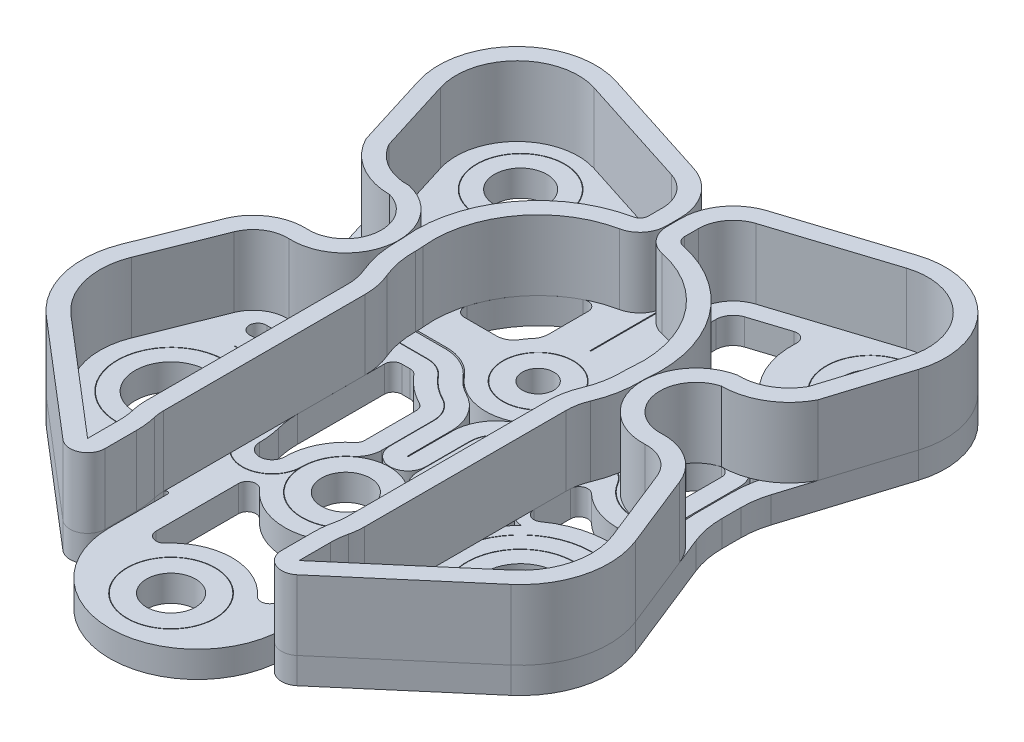
from build123d import *

# Parameters (mm, degrees)
BOSS_EXTRUDE1_START       = -3
BOSS_EXTRUDE1_OUTLINE_R   = 4.125000006
BOSS_EXTRUDE1_OUTLINE_R_2 = 2.8
BOSS_EXTRUDE1_OUTLINE_R_3 = 4.124999988
BOSS_EXTRUDE1_OUTLINE_R_4 = 1.800000002
BOSS_EXTRUDE1_OUTLINE_R_5 = 2.999999989
BOSS_EXTRUDE1_OUTLINE_R_6 = 3
BOSS_EXTRUDE1_DEPTH       = 3
EXTRUDE_THIN1_DEPTH       = 8
CUT_EXTRUDE_THIN1_START   = -3
SKETCH5_R                 = 5.049999989
SKETCH5_R_2               = 4.999999989
SKETCH5_R_3               = 5.05
SKETCH5_R_4               = 5
SKETCH5_R_5               = 4.05
SKETCH5_R_6               = 4
SKETCH5_R_7               = 5.050000041
SKETCH5_R_8               = 5.000000041
SKETCH5_R_9               = 6.175000006
SKETCH5_R_10              = 6.125000006
SKETCH5_R_11              = 6.174999988
SKETCH5_R_12              = 6.124999988
SKETCH5_R_13              = 5.049999983
SKETCH5_R_14              = 4.999999983
CUT_EXTRUDE_THIN1_DEPTH   = 3


# Read off the part's stored shape, not the designer's step: Boss-Extrude1
with BuildPart() as part:
    # Boss-Extrude1 outline → Boss-Extrude1 (new body)
    with BuildSketch(Plane(origin=(0, 0, 0), x_dir=(1, 0, 0), z_dir=(0, 1, 0)).offset(BOSS_EXTRUDE1_START)):
        with BuildLine():
            ThreePointArc((10.366684446, -31.537922044), (10.166894874, -32.677211811), (10.100000021, -33.831950797))
            Line((10.100000021, -33.831950797), (10.100000021, -37.450766032))
            ThreePointArc((10.100000021, -37.450766032), (11.263415083, -39.267390826), (13.400125663, -38.970526973))
            Line((13.400125663, -38.970526973), (26.581886082, -27.693789751))
            ThreePointArc((26.581886082, -27.693789751), (29.830051388, -22.426049301), (29.405725801, -16.251940856))
            Line((29.405725801, -16.251940856), (24.835394483, -4.782729235))
            ThreePointArc((24.835394483, -4.782729235), (24.304204469, -2.965609858), (24.125000186, -1.080942384))
            Line((24.125000186, -1.080942384), (24.125000186, 1.080942114))
            ThreePointArc((24.125000186, 1.080942114), (24.239058088, 2.586979102), (24.578629813, 4.058661017))
            Line((24.578629813, 4.058661017), (28.591733604, 16.924407756))
            ThreePointArc((28.591733604, 16.924407756), (26.338601086, 25.993575357), (17.251798885, 28.174500129))
            Line((17.251798885, 28.174500129), (4.217865917, 23.994889669))
            ThreePointArc((4.217865917, 23.994889669), (1.202691228, 21.817502134), (0.049999988, 18.281459461))
            Line((0.049999988, 18.281459461), (0.049999988, 7.999791662))
            ThreePointArc((0.049999988, 7.999791662), (-4.5e-08, 7.94979163), (-0.050000077, 7.999791662))
            Line((-0.050000077, 7.999791662), (-0.050000077, 18.28145946))
            ThreePointArc((-0.050000077, 18.28145946), (-1.202691317, 21.817502134), (-4.217866006, 23.994889669))
            Line((-4.217866006, 23.994889669), (-17.251798974, 28.174500129))
            ThreePointArc((-17.251798974, 28.174500129), (-26.33860103, 25.993575269), (-28.591733546, 16.924407792))
            Line((-28.591733546, 16.924407792), (-24.578629771, 4.058661048))
            ThreePointArc((-24.578629771, 4.058661048), (-24.239058048, 2.586979133), (-24.125000147, 1.080942144))
            Line((-24.125000147, 1.080942144), (-24.12500015, -1.080942354))
            ThreePointArc((-24.12500015, -1.080942354), (-24.304204435, -2.965609828), (-24.835394452, -4.782729204))
            Line((-24.835394452, -4.782729204), (-29.405725784, -16.251940819))
            ThreePointArc((-29.405725784, -16.251940819), (-29.830051377, -22.42604928), (-26.581886075, -27.693789751))
            Line((-26.581886075, -27.693789751), (-13.400125624, -38.970526972))
            ThreePointArc((-13.400125624, -38.970526972), (-11.263415045, -39.267390826), (-10.099999983, -37.450766032))
            Line((-10.099999983, -37.450766032), (-10.099999983, -33.831950797))
            ThreePointArc((-10.099999983, -33.831950797), (-10.166894835, -32.677211811), (-10.366684408, -31.537922044))
            ThreePointArc((-10.366684408, -31.537922044), (-10.467591951, -30.959497747), (-10.499995379, -30.373232433))
            ThreePointArc((-10.499995379, -30.373232433), (-10.24955658, -30.124118101), (-9.999999983, -30.374116195))
            Line((-9.999999983, -30.374116195), (-9.999999983, -36.999999952))
            ThreePointArc((-9.999999983, -36.999999952), (3e-09, -46.999999937), (9.999999989, -36.999999952))
            Line((9.999999989, -36.999999952), (9.999999989, -30.374999952))
            ThreePointArc((9.999999989, -30.374999952), (10.24911623, -30.125001514), (10.499993741, -30.373232445))
            ThreePointArc((10.499993741, -30.373232445), (10.46759199, -30.959497747), (10.366684446, -31.537922044))
        make_face()
        with BuildLine():
            Line((-12.499999988, -29.028600358), (-12.499982882, -30.36616234))
            ThreePointArc((-12.499982882, -30.36616234), (-12.454618084, -31.186933779), (-12.313347523, -31.996727795))
            ThreePointArc((-12.313347523, -31.996727795), (-12.153515864, -32.908159608), (-12.099999983, -33.831950797))
            Line((-12.099999983, -33.831950797), (-12.099999983, -37.450766032))
            Line((-12.099999983, -37.450766032), (-18.789338773, -31.728167961))
            ThreePointArc((-18.789338773, -31.728167961), (-19.103097329, -30.701738639), (-18.306532101, -29.982374043))
            ThreePointArc((-18.306532101, -29.982374043), (-16.094353466, -29.341389081), (-14.084269657, -28.217040775))
            ThreePointArc((-14.084269657, -28.217040775), (-13.044077663, -28.138580786), (-12.499999988, -29.028600358))
        make_face(mode=Mode.SUBTRACT)
        with Locations((-19.999999908, -20.000000019)):
            Circle(BOSS_EXTRUDE1_OUTLINE_R, mode=Mode.SUBTRACT)
        with BuildLine():
            Line((-11.800000029, -12.520592954), (-11.800000029, -15.023492615))
            ThreePointArc((-11.800000029, -15.023492615), (-11.799396788, -15.140252604), (-11.797587127, -15.257000126))
            ThreePointArc((-11.797587127, -15.257000126), (-12.499913264, -14.209980688), (-13.3350313, -13.265475752))
            ThreePointArc((-13.3350313, -13.265475752), (-12.495888638, -13.040641099), (-11.800000029, -12.520592954))
        make_face(mode=Mode.SUBTRACT)
        with BuildLine():
            ThreePointArc((-7.000000022, -20.000000001), (-8.437500022, -21.437500001), (-9.875000022, -20.000000001))
            ThreePointArc((-9.875000022, -20.000000001), (-9.953917828, -18.738311629), (-10.189441019, -17.496291342))
            ThreePointArc((-10.189441019, -17.496291342), (-10.422056523, -16.269604636), (-10.500000041, -15.023492661))
            Line((-10.500000041, -15.023492661), (-10.500000041, -5.1))
            ThreePointArc((-10.500000041, -5.1), (-10.207106823, -4.392893218), (-9.500000041, -4.1))
            Line((-9.500000041, -4.1), (-8.532291636, -4.1))
            ThreePointArc((-8.532291636, -4.1), (-8.107815272, -4.194560982), (-7.763616711, -4.460360368))
            ThreePointArc((-7.763616711, -4.460360368), (-6.307868974, -5.88801555), (-4.595045074, -6.994195953))
            ThreePointArc((-4.595045074, -6.994195953), (-4.197077126, -7.362673507), (-4.050000029, -7.884710405))
            Line((-4.050000029, -7.884710405), (-4.050000029, -13.795364617))
            ThreePointArc((-4.050000029, -13.795364617), (-4.146880436, -14.224753722), (-4.418750031, -14.570944045))
            ThreePointArc((-4.418750031, -14.570944045), (-6.321837178, -16.994276291), (-7.000000022, -20.000000001))
        make_face(mode=Mode.SUBTRACT)
        with Locations((1.9e-08, -40.000000001)):
            Circle(BOSS_EXTRUDE1_OUTLINE_R_2, mode=Mode.SUBTRACT)
        with BuildLine():
            ThreePointArc((-5.249999973, -35.369935327), (-6.353553365, -35.643911857), (-6.999999981, -34.708497509))
            Line((-6.999999981, -34.708497509), (-6.999999981, -25.291502623))
            ThreePointArc((-6.999999981, -25.291502623), (-6.353553371, -24.356088277), (-5.249999981, -24.630064796))
            ThreePointArc((-5.249999981, -24.630064796), (1.9e-08, -27.000000001), (5.250000019, -24.630064796))
            ThreePointArc((5.250000019, -24.630064796), (6.353553409, -24.356088277), (7.000000019, -25.291502623))
            Line((7.000000019, -25.291502623), (7.000000019, -34.708497509))
            ThreePointArc((7.000000019, -34.708497509), (6.353553404, -35.643911857), (5.250000011, -35.369935327))
            ThreePointArc((5.250000011, -35.369935327), (1.9e-08, -33.000000087), (-5.249999973, -35.369935327))
        make_face(mode=Mode.SUBTRACT)
        with BuildLine():
            ThreePointArc((12.100000021, -33.831950797), (12.153515903, -32.908159608), (12.313347561, -31.996727795))
            ThreePointArc((12.313347561, -31.996727795), (12.454618123, -31.186933779), (12.499982921, -30.36616234))
            Line((12.499982921, -30.36616234), (12.500000027, -29.028600358))
            ThreePointArc((12.500000027, -29.028600358), (13.044077702, -28.138580786), (14.084269696, -28.217040774))
            ThreePointArc((14.084269696, -28.217040774), (16.09435347, -29.341389067), (18.306532066, -29.982374031))
            ThreePointArc((18.306532066, -29.982374031), (19.103097358, -30.701738603), (18.789338812, -31.728167961))
            Line((18.789338812, -31.728167961), (12.100000021, -37.450766032))
            Line((12.100000021, -37.450766032), (12.100000021, -33.831950797))
        make_face(mode=Mode.SUBTRACT)
        with Locations((5e-08, -20.000000023)):
            Circle(BOSS_EXTRUDE1_OUTLINE_R_2, mode=Mode.SUBTRACT)
        with BuildLine():
            ThreePointArc((9.499999996, -4.100000011), (10.207106869, -4.392893148), (10.500000169, -5.099999954))
            Line((10.500000169, -5.099999954), (10.500000169, -15.023492615))
            ThreePointArc((10.500000169, -15.023492615), (10.422056655, -16.269604611), (10.189441149, -17.496291337))
            ThreePointArc((10.189441149, -17.496291337), (9.953917952, -18.738311635), (9.875000145, -20.000000019))
            ThreePointArc((9.875000145, -20.000000019), (8.437500094, -21.437500052), (7.000000061, -20.000000001))
            ThreePointArc((7.000000061, -20.000000001), (6.32183723, -16.994276317), (4.418750115, -14.570944082))
            ThreePointArc((4.418750115, -14.570944082), (4.146880525, -14.22475376), (4.05000012, -13.795364659))
            Line((4.05000012, -13.795364659), (4.05000012, -7.884710518))
            ThreePointArc((4.05000012, -7.884710518), (4.197077165, -7.362673618), (4.595045084, -6.99419605))
            ThreePointArc((4.595045084, -6.99419605), (6.307868993, -5.888015628), (7.763616737, -4.460360426))
            ThreePointArc((7.763616737, -4.460360426), (8.107815259, -4.194561029), (8.532291591, -4.100000011))
            Line((8.532291591, -4.100000011), (9.499999996, -4.100000011))
        make_face(mode=Mode.SUBTRACT)
        with BuildLine():
            Line((11.800000129, -15.023492614), (11.800000129, -12.520592954))
            ThreePointArc((11.800000129, -12.520592954), (12.495888738, -13.040641098), (13.3350314, -13.265475751))
            ThreePointArc((13.3350314, -13.265475751), (12.499913364, -14.209980687), (11.797587227, -15.257000125))
            ThreePointArc((11.797587227, -15.257000125), (11.799396888, -15.140252603), (11.800000129, -15.023492614))
        make_face(mode=Mode.SUBTRACT)
        with Locations((20.000000088, -20.000000019)):
            Circle(BOSS_EXTRUDE1_OUTLINE_R_3, mode=Mode.SUBTRACT)
        with BuildLine():
            ThreePointArc((-12.500000041, -10.971399616), (-13.044077714, -11.861419184), (-14.084269704, -11.782959203))
            ThreePointArc((-14.084269704, -11.782959203), (-17.375409345, -10.22108654), (-21.006312458, -9.92513226))
            ThreePointArc((-21.006312458, -9.92513226), (-22.069812691, -8.962566143), (-21.006312458, -8.000000025))
            Line((-21.006312458, -8.000000025), (-19.000000038, -8.000000025))
            ThreePointArc((-19.000000038, -8.000000025), (-16.40992615, -7.503192876), (-14.187500041, -6.08329067))
            ThreePointArc((-14.187500041, -6.08329067), (-13.104715334, -5.890916394), (-12.500000041, -6.809475047))
            Line((-12.500000041, -6.809475047), (-12.500000041, -10.971399616))
        make_face(mode=Mode.SUBTRACT)
        with BuildLine():
            ThreePointArc((-19, 4), (-17.025158234, 3.478505426), (-15.565251101, 2.05))
            ThreePointArc((-15.565251101, 2.05), (-14.105343968, 0.621494574), (-12.130502202, 0.1))
            Line((-12.130502202, 0.1), (-8.566796367, 0.1))
            ThreePointArc((-8.566796367, 0.1), (-6.408303627, -0.389910301), (-4.672798019, -1.763636364))
            ThreePointArc((-4.672798019, -1.763636364), (0, -4), (4.672798019, -1.763636364))
            ThreePointArc((4.672798019, -1.763636364), (6.408303627, -0.389910301), (8.566796367, 0.1))
            Line((8.566796367, 0.1), (12.130502313, 0.1))
            ThreePointArc((12.130502313, 0.1), (14.599054505, 0.751868209), (16.423938419, 2.53749997))
            ThreePointArc((16.423938419, 2.53749997), (17.518868733, 3.608878994), (19.000000003, 3.999999907))
            ThreePointArc((19.000000003, 3.999999907), (19.707106773, 3.70710674), (19.999999982, 2.999999987))
            Line((19.999999982, 2.999999987), (19.999999982, -3.000000013))
            ThreePointArc((19.999999982, -3.000000013), (19.707106794, -3.707106719), (19.000000088, -3.999999907))
            ThreePointArc((19.000000088, -3.999999907), (17.518868765, -3.608879012), (16.423938412, -2.537499959))
            ThreePointArc((16.423938412, -2.537499959), (14.599054496, -0.751868185), (12.130502295, -0.099999971))
            Line((12.130502295, -0.099999971), (8.532291702, -0.099999971))
            ThreePointArc((8.532291702, -0.099999971), (6.409909857, -0.572804886), (4.688917035, -1.901801836))
            ThreePointArc((4.688917035, -1.901801836), (3.809703055, -2.764049031), (2.775225253, -3.43213819))
            ThreePointArc((2.775225253, -3.43213819), (0.785385542, -5.274525951), (0.050000069, -7.884710416))
            Line((0.050000069, -7.884710416), (0.050000069, -12.89999996))
            ThreePointArc((0.050000069, -12.89999996), (1.5e-08, -12.950000013), (-0.050000038, -12.89999996))
            Line((-0.050000038, -12.89999996), (-0.050000038, -7.884710416))
            ThreePointArc((-0.050000038, -7.884710416), (-0.785385526, -5.274525927), (-2.775225263, -3.432138156))
            ThreePointArc((-2.775225263, -3.432138156), (-3.809703045, -2.764048994), (-4.688917007, -1.901801802))
            ThreePointArc((-4.688917007, -1.901801802), (-6.409909803, -0.572804898), (-8.532291603, -0.1))
            Line((-8.532291603, -0.1), (-12.130502202, -0.1))
            ThreePointArc((-12.130502202, -0.1), (-14.105343968, -0.621494574), (-15.565251101, -2.05))
            ThreePointArc((-15.565251101, -2.05), (-17.025158234, -3.478505426), (-19, -4))
            ThreePointArc((-19, -4), (-19.70710676, -3.707106785), (-19.999999975, -3.000000013))
            Line((-19.999999975, -3.000000013), (-19.999999975, 3))
            ThreePointArc((-19.999999975, 3), (-19.707106765, 3.707106772), (-19, 4))
        make_face(mode=Mode.SUBTRACT)
        with BuildLine():
            ThreePointArc((-5.508883445, 12.666376335), (-4.529847832, 12.631953466), (-4.05, 11.777879861))
            Line((-4.05, 11.777879861), (-4.05, 7.234262126))
            ThreePointArc((-4.05, 7.234262126), (-4.175833519, 6.536050124), (-4.5375, 5.925696594))
            ThreePointArc((-4.5375, 5.925696594), (-4.863447474, 5.513812554), (-5.152123349, 5.075))
            ThreePointArc((-5.152123349, 5.075), (-5.882076915, 4.360747287), (-6.869497798, 4.1))
            Line((-6.869497798, 4.1), (-10.559329267, 4.1))
            ThreePointArc((-10.559329267, 4.1), (-11.359857476, 4.500704926), (-11.518834493, 5.381690827))
            ThreePointArc((-11.518834493, 5.381690827), (-9.26026216, 9.639824975), (-5.508883445, 12.666376335))
        make_face(mode=Mode.SUBTRACT)
        with Locations((-8e-09, 2.000000028)):
            Circle(BOSS_EXTRUDE1_OUTLINE_R_4, mode=Mode.SUBTRACT)
        with Locations((-19.999999908, 20.000000019)):
            Circle(BOSS_EXTRUDE1_OUTLINE_R_5, mode=Mode.SUBTRACT)
        with BuildLine():
            ThreePointArc((-4.050000077, 16.129639772), (-4.232517636, 15.553686251), (-4.713444993, 15.187975991))
            ThreePointArc((-4.713444993, 15.187975991), (-9.755393979, 12.04846071), (-13.042728056, 7.101619249))
            ThreePointArc((-13.042728056, 7.101619249), (-13.675903647, 6.511361893), (-14.532462816, 6.636347754))
            ThreePointArc((-14.532462816, 6.636347754), (-16.664489566, 7.651495999), (-19, 8))
            Line((-19, 8), (-20.570425549, 8))
            ThreePointArc((-20.570425549, 8), (-21.162974326, 8.194465428), (-21.5250626, 8.702228106))
            Line((-21.5250626, 8.702228106), (-21.953069074, 10.074388629))
            ThreePointArc((-21.953069074, 10.074388629), (-21.789238639, 10.799431359), (-21.095724924, 11.066949767))
            ThreePointArc((-21.095724924, 11.066949767), (-13.835038202, 13.443076459), (-11.016438541, 20.543713451))
            ThreePointArc((-11.016438541, 20.543713451), (-10.631750688, 21.393831932), (-9.712909372, 21.556364423))
            Line((-9.712909372, 21.556364423), (-5.43928872, 20.185936201))
            ThreePointArc((-5.43928872, 20.185936201), (-4.43423049, 19.460140356), (-4.050000077, 18.281459465))
            Line((-4.050000077, 18.281459465), (-4.050000077, 16.129639772))
        make_face(mode=Mode.SUBTRACT)
        with BuildLine():
            ThreePointArc((2.050000134, -7.884710456), (2.49123142, -6.318599774), (3.685135246, -5.213167112))
            ThreePointArc((3.685135246, -5.213167112), (5.058786093, -4.326032313), (6.226266944, -3.181081107))
            ThreePointArc((6.226266944, -3.181081107), (7.258862613, -2.383682894), (8.532291719, -2.099999905))
            Line((8.532291719, -2.099999905), (12.130502296, -2.099999905))
            ThreePointArc((12.130502296, -2.099999905), (13.611633621, -2.491120835), (14.706563971, -3.562499905))
            ThreePointArc((14.706563971, -3.562499905), (16.53144789, -5.348131689), (19.0000001, -5.999999907))
            ThreePointArc((19.0000001, -5.999999907), (21.121320357, -5.121320282), (21.999999982, -3.000000013))
            Line((21.999999982, -3.000000013), (21.999999982, 3.000000013))
            ThreePointArc((21.999999982, 3.000000013), (21.121320327, 5.121320312), (19.000000003, 5.999999907))
            Line((19.000000003, 5.999999907), (20.570425648, 5.999999907))
            ThreePointArc((20.570425648, 5.999999907), (22.348071979, 6.58339619), (23.434336801, 8.106684225))
            Line((23.434336801, 8.106684225), (22.669355526, 5.654204715))
            ThreePointArc((22.669355526, 5.654204715), (22.261869626, 3.888186581), (22.125000258, 2.080942384))
            Line((22.125000258, 2.080942384), (22.125000258, -2.080942384))
            ThreePointArc((22.125000258, -2.080942384), (22.261869656, -3.888186776), (22.669355643, -5.654205092))
            Line((22.669355643, -5.654205092), (23.434336829, -8.106684315))
            ThreePointArc((23.434336829, -8.106684315), (22.561254366, -6.755762693), (21.115861254, -6.050000006))
            Line((21.115861254, -6.050000006), (19.0000001, -6.050000006))
            ThreePointArc((19.0000001, -6.050000006), (16.514517402, -5.396006805), (14.67279264, -3.603416153))
            ThreePointArc((14.67279264, -3.603416153), (13.578698723, -2.538510816), (12.10217435, -2.150000004))
            Line((12.10217435, -2.150000004), (8.532291719, -2.150000004))
            ThreePointArc((8.532291719, -2.150000004), (7.280086445, -2.428954899), (6.26470069, -3.213063088))
            ThreePointArc((6.26470069, -3.213063088), (5.090013168, -4.365081895), (3.707882994, -5.257692835))
            ThreePointArc((3.707882994, -5.257692835), (2.533877565, -6.344701619), (2.100000134, -7.884710456))
            Line((2.100000134, -7.884710456), (2.100000134, -13.795364632))
            ThreePointArc((2.100000134, -13.795364632), (2.385797318, -15.062062475), (3.1878126, -16.083323923))
            ThreePointArc((3.1878126, -16.083323923), (4.560754048, -17.831585049), (5.050000103, -20.000000019))
            ThreePointArc((5.050000103, -20.000000019), (8.437500108, -23.38750001), (11.825000103, -20.00000001))
            ThreePointArc((11.825000103, -20.00000001), (14.514181846, -13.93894211), (20.812504202, -11.865477179))
            ThreePointArc((20.812504202, -11.865477179), (20.834895697, -11.892838118), (20.807534758, -11.915229612))
            ThreePointArc((20.807534758, -11.915229612), (14.547734251, -13.9760128), (11.875000103, -20.00000001))
            ThreePointArc((11.875000103, -20.00000001), (8.437500108, -23.43750001), (5.000000103, -20.000000021))
            ThreePointArc((5.000000103, -20.000000021), (5.1e-08, -14.99999997), (-5.000000003, -20.000000019))
            ThreePointArc((-5.000000003, -20.000000019), (-8.437500003, -23.437500019), (-11.875000003, -20.000000019))
            ThreePointArc((-11.875000003, -20.000000019), (-14.547734148, -13.976012803), (-20.807534658, -11.915229612))
            ThreePointArc((-20.807534658, -11.915229612), (-20.834895597, -11.892838118), (-20.812504102, -11.865477179))
            ThreePointArc((-20.812504102, -11.865477179), (-14.514181743, -13.938942113), (-11.825000003, -20.000000019))
            ThreePointArc((-11.825000003, -20.000000019), (-8.437500003, -23.387500019), (-5.050000003, -20.000000019))
            ThreePointArc((-5.050000003, -20.000000019), (-4.560753949, -17.831585049), (-3.187812501, -16.083323923))
            ThreePointArc((-3.187812501, -16.083323923), (-2.385797219, -15.062062475), (-2.100000034, -13.795364632))
            Line((-2.100000034, -13.795364632), (-2.100000034, -7.884710456))
            ThreePointArc((-2.100000034, -7.884710456), (-2.533877466, -6.344701619), (-3.707882895, -5.257692835))
            ThreePointArc((-3.707882895, -5.257692835), (-5.090013068, -4.365081895), (-6.26470059, -3.213063088))
            ThreePointArc((-6.26470059, -3.213063088), (-7.280086345, -2.428954899), (-8.532291619, -2.150000004))
            Line((-8.532291619, -2.150000004), (-12.102174251, -2.150000004))
            ThreePointArc((-12.102174251, -2.150000004), (-13.578698624, -2.538510816), (-14.67279254, -3.603416153))
            ThreePointArc((-14.67279254, -3.603416153), (-16.514517303, -5.396006805), (-19, -6.050000006))
            Line((-19, -6.050000006), (-21.670047442, -6.050000006))
            ThreePointArc((-21.670047442, -6.050000006), (-22.413378339, -6.300483225), (-23.065105729, -6.736985315))
            ThreePointArc((-23.065105729, -6.736985315), (-22.362374299, -4.45594419), (-22.125000129, -2.080942384))
            Line((-22.125000129, -2.080942384), (-22.125000129, 2.080942377))
            ThreePointArc((-22.125000129, 2.080942377), (-22.261869527, 3.888186774), (-22.669355515, 5.654205095))
            Line((-22.669355515, 5.654205095), (-23.434336702, 8.106684317))
            ThreePointArc((-23.434336702, 8.106684317), (-22.348071879, 6.583396283), (-20.570425549, 6))
            Line((-20.570425549, 6), (-18.999999988, 6))
            ThreePointArc((-18.999999988, 6), (-21.121320327, 5.121320345), (-21.999999982, 3.000000006))
            Line((-21.999999982, 3.000000006), (-21.999999982, -3.000000013))
            ThreePointArc((-21.999999982, -3.000000013), (-21.121320327, -5.121320352), (-18.999999988, -6.000000006))
            ThreePointArc((-18.999999988, -6.000000006), (-16.53144779, -5.348131788), (-14.706563871, -3.562500004))
            ThreePointArc((-14.706563871, -3.562500004), (-13.611633521, -2.491120934), (-12.130502197, -2.100000004))
            Line((-12.130502197, -2.100000004), (-8.532291619, -2.100000004))
            ThreePointArc((-8.532291619, -2.100000004), (-7.258862527, -2.383682949), (-6.226266844, -3.181081107))
            ThreePointArc((-6.226266844, -3.181081107), (-5.058785993, -4.326032313), (-3.685135147, -5.213167112))
            ThreePointArc((-3.685135147, -5.213167112), (-2.49123132, -6.318599774), (-2.050000034, -7.884710456))
            Line((-2.050000034, -7.884710456), (-2.050000034, -12.899999964))
            ThreePointArc((-2.050000034, -12.899999964), (5e-08, -14.950000048), (2.050000134, -12.899999964))
            Line((2.050000134, -12.899999964), (2.050000134, -7.884710456))
        make_face(mode=Mode.SUBTRACT)
        with BuildLine():
            ThreePointArc((11.518834493, 5.381690827), (11.359857476, 4.500704926), (10.559329267, 4.1))
            Line((10.559329267, 4.1), (6.869497798, 4.1))
            ThreePointArc((6.869497798, 4.1), (5.882076915, 4.360747287), (5.152123349, 5.075))
            ThreePointArc((5.152123349, 5.075), (4.863447474, 5.513812554), (4.5375, 5.925696594))
            ThreePointArc((4.5375, 5.925696594), (4.175833519, 6.536050124), (4.05, 7.234262126))
            Line((4.05, 7.234262126), (4.05, 11.777879861))
            ThreePointArc((4.05, 11.777879861), (4.529847832, 12.631953466), (5.508883445, 12.666376335))
            ThreePointArc((5.508883445, 12.666376335), (9.26026216, 9.639824975), (11.518834493, 5.381690827))
        make_face(mode=Mode.SUBTRACT)
        with BuildLine():
            ThreePointArc((14.084269789, -11.782959204), (13.0440778, -11.861419183), (12.500000129, -10.971399616))
            Line((12.500000129, -10.971399616), (12.500000129, -6.809475023))
            ThreePointArc((12.500000129, -6.809475023), (13.104715416, -5.890916372), (14.18750012, -6.083290638))
            ThreePointArc((14.18750012, -6.083290638), (16.409926182, -7.503192788), (19.000000003, -7.999999916))
            Line((19.000000003, -7.999999916), (20.735075088, -7.999999916))
            ThreePointArc((20.735075088, -7.999999916), (21.757665243, -8.950859212), (20.735075088, -9.901718508))
            ThreePointArc((20.735075088, -9.901718508), (17.244176441, -10.257256013), (14.084269789, -11.782959204))
        make_face(mode=Mode.SUBTRACT)
        with BuildLine():
            ThreePointArc((9.712909332, 21.556364462), (10.63175065, 21.393831969), (11.016438501, 20.543713485))
            ThreePointArc((11.016438501, 20.543713485), (13.729487537, 13.543942809), (20.805375194, 11.0361074))
            ThreePointArc((20.805375194, 11.0361074), (21.673048481, 10.668151791), (21.849498388, 9.742347442))
            Line((21.849498388, 9.742347442), (21.525062699, 8.702228013))
            ThreePointArc((21.525062699, 8.702228013), (21.162974425, 8.194465335), (20.570425648, 7.999999907))
            Line((20.570425648, 7.999999907), (19.000000003, 7.999999907))
            ThreePointArc((19.000000003, 7.999999907), (16.705415945, 7.613235419), (14.664392927, 6.49568103))
            ThreePointArc((14.664392927, 6.49568103), (13.776739918, 6.317437508), (13.108996115, 6.928843126))
            ThreePointArc((13.108996115, 6.928843126), (9.821566576, 11.983792066), (4.713444909, 15.187976016))
            ThreePointArc((4.713444909, 15.187976016), (4.232517551, 15.553686275), (4.049999992, 16.129639796))
            Line((4.049999992, 16.129639796), (4.049999992, 18.28145949))
            ThreePointArc((4.049999992, 18.28145949), (4.434230406, 19.460140381), (5.439288635, 20.185936226))
            Line((5.439288635, 20.185936226), (9.712909332, 21.556364462))
        make_face(mode=Mode.SUBTRACT)
        with Locations((19.999999943, 20)):
            Circle(BOSS_EXTRUDE1_OUTLINE_R_6, mode=Mode.SUBTRACT)
    extrude(amount=BOSS_EXTRUDE1_DEPTH)

    # Sketch5 → Cut-Extrude-Thin1 (cut)
    # profile 1 of 7: a face of its own
    with BuildSketch(Plane(origin=(0, 0, 0), x_dir=(1, 0, 0), z_dir=(0, 1, 0)).offset(CUT_EXTRUDE_THIN1_START)):
        with Locations((-19.999999908, 20.000000019)):
            Circle(SKETCH5_R)
        with Locations((-19.999999908, 20.000000019)):
            Circle(SKETCH5_R_2, mode=Mode.SUBTRACT)
    # profile 2 of 7: a face of its own
    with BuildSketch(Plane(origin=(0, 0, 0), x_dir=(1, 0, 0), z_dir=(0, 1, 0)).offset(CUT_EXTRUDE_THIN1_START)):
        with Locations((19.999999943, 20)):
            Circle(SKETCH5_R_3)
        with Locations((19.999999943, 20)):
            Circle(SKETCH5_R_4, mode=Mode.SUBTRACT)
    # profile 3 of 7: a face of its own
    with BuildSketch(Plane(origin=(0, 0, 0), x_dir=(1, 0, 0), z_dir=(0, 1, 0)).offset(CUT_EXTRUDE_THIN1_START)):
        with Locations((0, 2)):
            Circle(SKETCH5_R_5)
        with Locations((0, 2)):
            Circle(SKETCH5_R_6, mode=Mode.SUBTRACT)
    # profile 4 of 7: a face of its own
    with BuildSketch(Plane(origin=(0, 0, 0), x_dir=(1, 0, 0), z_dir=(0, 1, 0)).offset(CUT_EXTRUDE_THIN1_START)):
        with Locations((1.9e-08, -20.000000001)):
            Circle(SKETCH5_R_7)
        with Locations((1.9e-08, -20.000000001)):
            Circle(SKETCH5_R_8, mode=Mode.SUBTRACT)
    # profile 5 of 7: a face of its own
    with BuildSketch(Plane(origin=(0, 0, 0), x_dir=(1, 0, 0), z_dir=(0, 1, 0)).offset(CUT_EXTRUDE_THIN1_START)):
        with Locations((-19.999999908, -20.000000019)):
            Circle(SKETCH5_R_9)
        with Locations((-19.999999908, -20.000000019)):
            Circle(SKETCH5_R_10, mode=Mode.SUBTRACT)
    # profile 6 of 7: a face of its own
    with BuildSketch(Plane(origin=(0, 0, 0), x_dir=(1, 0, 0), z_dir=(0, 1, 0)).offset(CUT_EXTRUDE_THIN1_START)):
        with Locations((20.000000088, -20.000000019)):
            Circle(SKETCH5_R_11)
        with Locations((20.000000088, -20.000000019)):
            Circle(SKETCH5_R_12, mode=Mode.SUBTRACT)
    # profile 7 of 7: a face of its own
    with BuildSketch(Plane(origin=(0, 0, 0), x_dir=(1, 0, 0), z_dir=(0, 1, 0)).offset(CUT_EXTRUDE_THIN1_START)):
        with Locations((1.9e-08, -40.000000001)):
            Circle(SKETCH5_R_13)
        with Locations((1.9e-08, -40.000000001)):
            Circle(SKETCH5_R_14, mode=Mode.SUBTRACT)
    extrude(amount=CUT_EXTRUDE_THIN1_DEPTH, mode=Mode.SUBTRACT)


with BuildPart() as body_2:
    # Sketch4 → Extrude-Thin1 (new body)
    with BuildSketch(Plane(origin=(0, 0, 0), x_dir=(1, 0, 0), z_dir=(0, 1, 0))):
        with BuildLine():
            Line((-10.499995379, -30.373232433), (-10.501372376, -7.285892114))
            ThreePointArc((-10.501372376, -7.285892114), (-10.658658616, -5.707335535), (-11.124332595, -4.190850263))
            ThreePointArc((-11.124332595, -4.190850263), (-11.724572132, -2.202836739), (-11.901259236, -0.133714476))
            ThreePointArc((-11.901259236, -0.133714476), (-11.906569465, 0.305359205), (-11.939011594, 0.743264908))
            ThreePointArc((-11.939011594, 0.743264908), (-9.696006666, 9.078618203), (-2.440202237, 13.754352129))
            ThreePointArc((-2.440202237, 13.754352129), (-0.723049979, 14.798233124), (-0.050000077, 16.691722823))
            Line((-0.050000077, 16.691722823), (-0.050000077, 18.28145946))
            ThreePointArc((-0.050000077, 18.28145946), (-1.202691317, 21.817502134), (-4.217866006, 23.994889669))
            Line((-4.217866006, 23.994889669), (-17.251798974, 28.174500129))
            ThreePointArc((-17.251798974, 28.174500129), (-26.33860103, 25.993575269), (-28.591733546, 16.924407792))
            Line((-28.591733546, 16.924407792), (-25.855835585, 8.153298881))
            ThreePointArc((-25.855835585, 8.153298881), (-23.007878924, 5.119309678), (-19, 4))
            ThreePointArc((-19, 4), (-15.987166533, -0.643172739), (-20.278864059, -4.138534085))
            ThreePointArc((-20.278864059, -4.138534085), (-23.766056562, -5.073415928), (-26.061632246, -7.859963594))
            Line((-26.061632246, -7.859963594), (-29.405725784, -16.251940819))
            ThreePointArc((-29.405725784, -16.251940819), (-29.830051373, -22.426049279), (-26.581886075, -27.693789751))
            Line((-26.581886075, -27.693789751), (-13.400125624, -38.970526972))
            ThreePointArc((-13.400125624, -38.970526972), (-11.263415045, -39.267390826), (-10.099999983, -37.450766032))
            Line((-10.099999983, -37.450766032), (-10.099999983, -33.831950797))
            ThreePointArc((-10.099999983, -33.831950797), (-10.166894835, -32.677211811), (-10.366684408, -31.537922044))
            ThreePointArc((-10.366684408, -31.537922044), (-10.467591951, -30.959497747), (-10.499995379, -30.373232433))
        make_face()
        with BuildLine():
            Line((-12.499995571, -30.370058687), (-12.501372377, -7.285947475))
            ThreePointArc((-12.501372377, -7.285947475), (-12.619331594, -6.102001816), (-12.96859254, -4.964610725))
            ThreePointArc((-12.96859254, -4.964610725), (-13.688879985, -2.578994497), (-13.900904509, -0.096047782))
            ThreePointArc((-13.900904509, -0.096047782), (-13.90471891, 0.219342962), (-13.928022435, 0.533894732))
            ThreePointArc((-13.928022435, 0.533894732), (-11.311338658, 10.257898727), (-2.84673413, 15.712599258))
            ThreePointArc((-2.84673413, 15.712599258), (-2.274350044, 16.06055959), (-2.050000077, 16.691722823))
            Line((-2.050000077, 16.691722823), (-2.050000077, 18.28145946))
            ThreePointArc((-2.050000077, 18.28145946), (-2.818460904, 20.638821242), (-4.828577363, 22.090412932))
            Line((-4.828577363, 22.090412932), (-17.862510331, 26.270023393))
            ThreePointArc((-17.862510331, 26.270023393), (-24.930023231, 24.573748314), (-26.682459284, 17.519951066))
            Line((-26.682459284, 17.519951066), (-24.004059842, 8.933178627))
            ThreePointArc((-24.004059842, 8.933178627), (-21.804898194, 6.732708554), (-18.780387489, 6.004206327))
            ThreePointArc((-18.780387489, 6.004206327), (-13.98924122, -0.799905659), (-20.374741633, -6.136234636))
            ThreePointArc((-20.374741633, -6.136234636), (-22.683731583, -6.755252019), (-24.203711101, -8.600320953))
            Line((-24.203711101, -8.600320953), (-27.547804657, -16.992298222))
            ThreePointArc((-27.547804657, -16.992298222), (-27.888312825, -21.946829692), (-25.281760423, -26.17402882))
            Line((-25.281760423, -26.17402882), (-12.099999983, -37.450766032))
            Line((-12.099999983, -37.450766032), (-12.099999983, -33.831950797))
            ThreePointArc((-12.099999983, -33.831950797), (-12.153515864, -32.908159608), (-12.313347523, -31.996727795))
            ThreePointArc((-12.313347523, -31.996727795), (-12.454396271, -31.188869294), (-12.499995571, -30.370058687))
        make_face(mode=Mode.SUBTRACT)
    extrude(amount=EXTRUDE_THIN1_DEPTH)


with BuildPart() as body_3:
    # Mirror1: mirrored copy
    add(body_2.part.mirror(Plane(origin=(0, 0, 0), x_dir=(0, 0, 1), z_dir=(1, 0, 0))))


with BuildPart() as cut_extrude_thin1_piece_1:
    # of the separate pieces the step leaves, piece 1, a body of its own (cut_extrude_thin1_pieces)
    add(part.part.solids().sort_by_distance((-24.578629771, -3, -4.058661048))[0])


with BuildPart() as cut_extrude_thin1_piece_2:
    # of the separate pieces the step leaves, piece 2, a body of its own (cut_extrude_thin1_pieces)
    add(part.part.solids().sort_by_distance((-13.874999902, -3, 20.000000019))[0])


with BuildPart() as cut_extrude_thin1_piece_3:
    # of the separate pieces the step leaves, piece 3, a body of its own (cut_extrude_thin1_pieces)
    add(part.part.solids().sort_by_distance((26.125000077, -3, 20.000000019))[0])


with BuildPart() as cut_extrude_thin1_piece_4:
    # of the separate pieces the step leaves, piece 4, a body of its own (cut_extrude_thin1_pieces)
    add(part.part.solids().sort_by_distance((-5.000000003, -3, 20.000000019))[0])


with BuildPart() as cut_extrude_thin1_piece_5:
    # of the separate pieces the step leaves, piece 5, a body of its own (cut_extrude_thin1_pieces)
    add(part.part.solids().sort_by_distance((5.000000002, -3, 40.000000001))[0])


with BuildPart() as cut_extrude_thin1_piece_6:
    # of the separate pieces the step leaves, piece 6, a body of its own (cut_extrude_thin1_pieces)
    add(part.part.solids().sort_by_distance((24.999999943, -3, -20))[0])


with BuildPart() as cut_extrude_thin1_piece_7:
    # of the separate pieces the step leaves, piece 7, a body of its own (cut_extrude_thin1_pieces)
    add(part.part.solids().sort_by_distance((-14.999999919, -3, -20.000000019))[0])


with BuildPart() as cut_extrude_thin1_piece_8:
    # of the separate pieces the step leaves, piece 8, a body of its own (cut_extrude_thin1_pieces)
    add(part.part.solids().sort_by_distance((4, -3, -2))[0])


solid = Compound([body_2.part, body_3.part, cut_extrude_thin1_piece_1.part, cut_extrude_thin1_piece_2.part, cut_extrude_thin1_piece_3.part, cut_extrude_thin1_piece_4.part, cut_extrude_thin1_piece_5.part, cut_extrude_thin1_piece_6.part, cut_extrude_thin1_piece_7.part, cut_extrude_thin1_piece_8.part])
